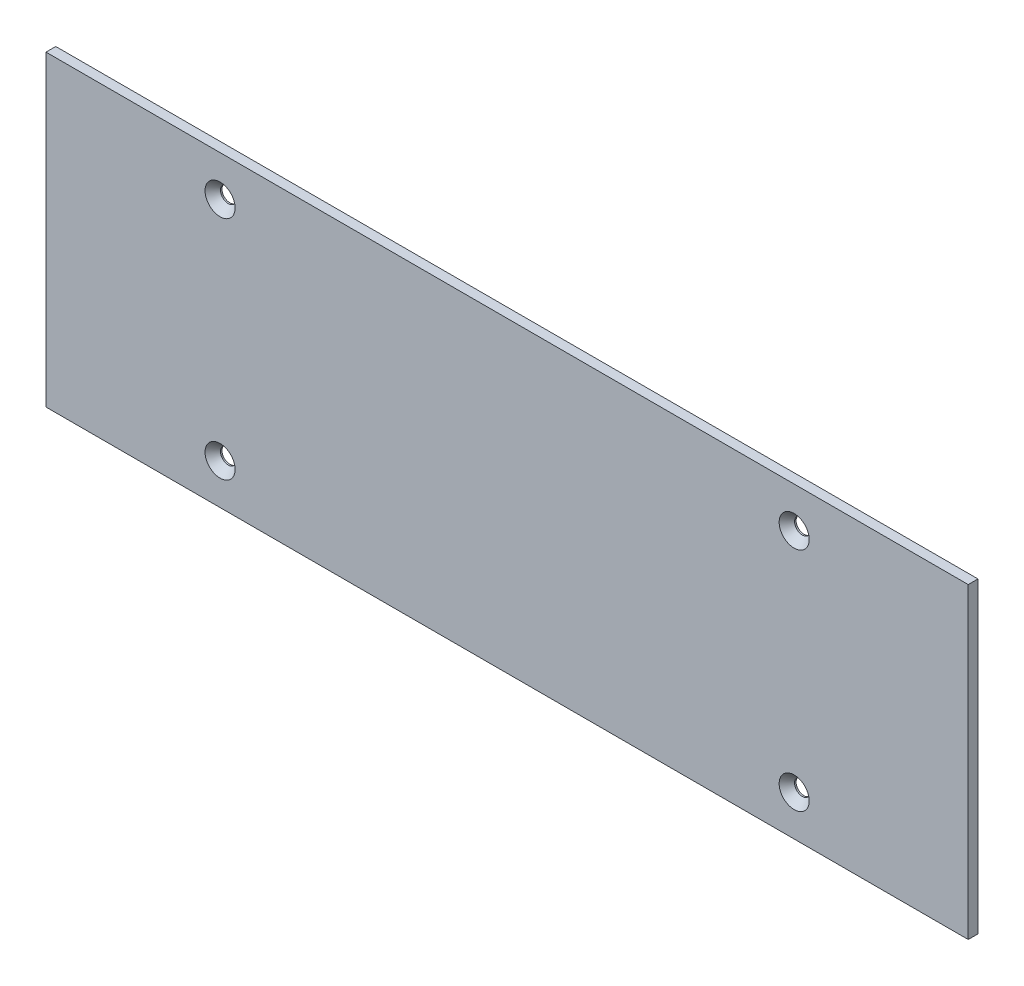
from build123d import *

# Parameters (mm, degrees)
SKETCH1_W                                       = 299.999999694
SKETCH1_H                                       = 99.999999898
BOSS_EXTRUDE1_DEPTH                             = 3.175
CSK_FOR_10_FLAT_HEAD_MACHINE_SCREW1_D           = 5.1054
CSK_FOR_10_FLAT_HEAD_MACHINE_SCREW1_DEPTH       = 4.826
CSK_FOR_10_FLAT_HEAD_MACHINE_SCREW1_CSINK_D     = 9.779
CSK_FOR_10_FLAT_HEAD_MACHINE_SCREW1_CSINK_ANGLE = 82
CSK_FOR_10_FLAT_HEAD_MACHINE_SCREW1_TIP         = 1.533816902


with BuildPart() as part:
    # Sketch1 → Boss-Extrude1 (new body)
    with BuildSketch(Plane.XY):
        Rectangle(SKETCH1_W, SKETCH1_H)
    extrude(amount=BOSS_EXTRUDE1_DEPTH)

    # CSK for #10 Flat Head Machine Screw1
    with Locations(Plane.XY.offset(3.175)):
        with Locations((93.374999847, 36.824999949), (-93.374999847, 36.824999949), (-93.374999847, -36.824999949), (93.374999847, -36.824999949)):
            CounterSinkHole(CSK_FOR_10_FLAT_HEAD_MACHINE_SCREW1_D / 2, CSK_FOR_10_FLAT_HEAD_MACHINE_SCREW1_CSINK_D / 2, depth=CSK_FOR_10_FLAT_HEAD_MACHINE_SCREW1_DEPTH, counter_sink_angle=CSK_FOR_10_FLAT_HEAD_MACHINE_SCREW1_CSINK_ANGLE)
            with Locations((0, 0, -(CSK_FOR_10_FLAT_HEAD_MACHINE_SCREW1_DEPTH + CSK_FOR_10_FLAT_HEAD_MACHINE_SCREW1_TIP / 2))):  # 118° drill point
                Cone(0, CSK_FOR_10_FLAT_HEAD_MACHINE_SCREW1_D / 2, CSK_FOR_10_FLAT_HEAD_MACHINE_SCREW1_TIP, mode=Mode.SUBTRACT)


solid = part.part
